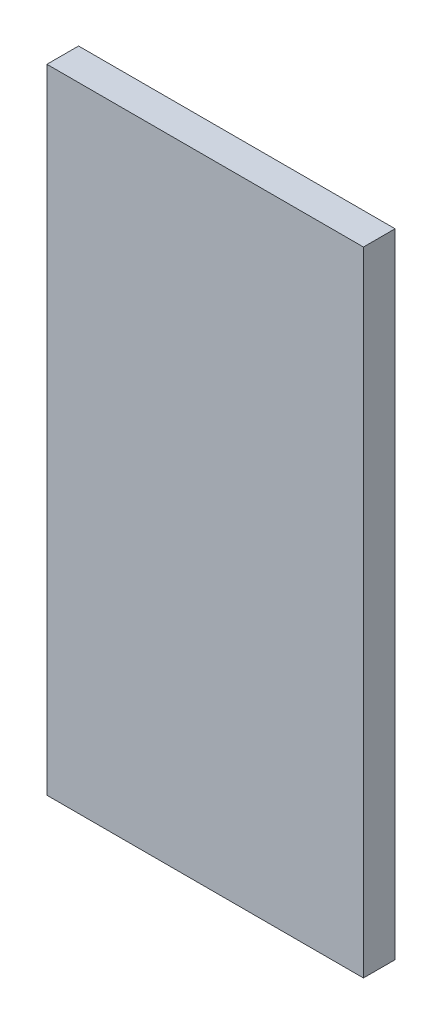
from build123d import *

# Parameters (mm, degrees)
SKETCH1_W           = 40
SKETCH1_H           = 80
BOSS_EXTRUDE1_DEPTH = 4


with BuildPart() as part:
    # Sketch1 → Boss-Extrude1 (new body)
    with BuildSketch(Plane.XY):
        Rectangle(SKETCH1_W, SKETCH1_H)
    extrude(amount=BOSS_EXTRUDE1_DEPTH)


solid = part.part
